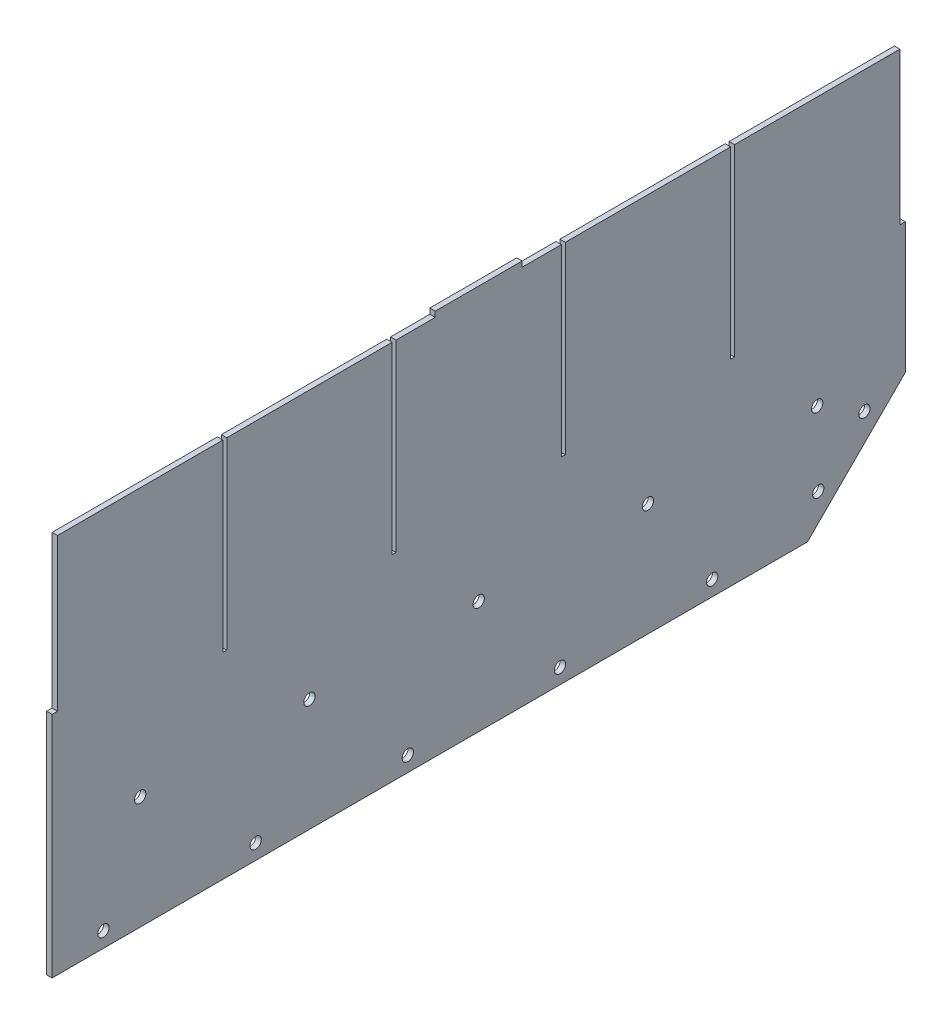
from build123d import *

# Parameters (mm, degrees)
SKETCH1_W            = 498.348
SKETCH1_H            = 165.1
BOSS_EXTRUDE1_DEPTH  = 1.5875
BOSS_EXTRUDE2_DEPTH  = 3.175
SKETCH3_R            = 3.302
CUT_EXTRUDE1_DEPTH   = 3.175
LPATTERN1_COUNT      = 5
LPATTERN1_PITCH      = 88.9
CUT_EXTRUDE2_DEPTH   = 286.681383539
LPATTERN2_COUNT      = 2
LPATTERN2_PITCH      = 38.1
SKETCH5_W            = 3.175
SKETCH5_H            = 88.9
CUT_EXTRUDE3_DEPTH   = 286.681383539
SKETCH6_W            = 2.286
SKETCH6_H            = 107.442
CUT_EXTRUDE4_DEPTH   = 286.681383539
LPATTERN3_COUNT      = 4
LPATTERN3_PITCH      = 98.8568
SKETCH7_W            = 50.8
SKETCH7_H            = 3.175
BOSS_EXTRUDE3_DEPTH  = 3.175
M6_CLEARANCE_HOLE1_D = 6.6
LPATTERN4_COUNT      = 3
LPATTERN4_PITCH      = 98.8568
LPATTERN4_COUNT_DIR2 = 3
LPATTERN4_PITCH_DIR2 = 98.8568


with BuildPart() as part:
    # Sketch1 → Boss-Extrude1 (new, symmetric)
    with BuildSketch(Plane(origin=(0, 0, 0), x_dir=(0, 0, -1), z_dir=(1, 0, 0))):
        Rectangle(SKETCH1_W, SKETCH1_H)
    extrude(amount=BOSS_EXTRUDE1_DEPTH, both=True)

    # Sketch2 → Boss-Extrude2 (add)
    with BuildSketch(Plane(origin=(1.5875, 0, 0), x_dir=(0, 0, -1), z_dir=(1, 0, 0))):
        Polygon((-249.174, -139.7), (192.024, -139.7), (249.174, -82.55), (-249.174, -82.55), align=None)
    extrude(amount=-BOSS_EXTRUDE2_DEPTH)

    # Sketch3 → Cut-Extrude1 (cut)
    with BuildSketch(Plane(origin=(1.5875, 0, 0), x_dir=(0, 0, -1), z_dir=(1, 0, 0))):
        with Locations((-219.202, -130.81)):
            Circle(SKETCH3_R)
    cut_extrude1 = extrude(amount=-CUT_EXTRUDE1_DEPTH, mode=Mode.SUBTRACT)

    # LPattern1: Cut-Extrude1 ×5
    with Locations(*[(0, 0, -i * LPATTERN1_PITCH) for i in range(1, LPATTERN1_COUNT)]):
        add(cut_extrude1, mode=Mode.SUBTRACT)

    # Sketch4 → Cut-Extrude2 (cut, through all)
    with BuildSketch(Plane(origin=(1.5875, 0, 0), x_dir=(0, 0, -1), z_dir=(1, 0, 0))):
        with BuildLine():
            ThreePointArc((195.975312693, -119.584226289), (199.573799978, -120.300009914), (201.612179285, -117.249359697))
            ThreePointArc((201.612179285, -117.249359697), (197.046558591, -114.198709481), (195.975312693, -119.584226289))
        make_face()
    cut_extrude2 = extrude(amount=-CUT_EXTRUDE2_DEPTH, mode=Mode.SUBTRACT)

    # LPattern2: Cut-Extrude2 ×2
    with Locations(*[Vector(0, 0.7071067811865489, -0.7071067811865461) * (i * LPATTERN2_PITCH) for i in range(1, LPATTERN2_COUNT)]):
        add(cut_extrude2, mode=Mode.SUBTRACT)

    # Sketch5 → Cut-Extrude3 (cut, through all)
    with BuildSketch(Plane.ZY.offset(1.5875)):
        with Locations((247.5865, 38.1)):
            Rectangle(SKETCH5_W, SKETCH5_H)
        with Locations((-247.5865, 38.1)):
            Rectangle(SKETCH5_W, SKETCH5_H)
    extrude(amount=-CUT_EXTRUDE3_DEPTH, mode=Mode.SUBTRACT)

    # Sketch6 → Cut-Extrude4 (cut, through all)
    with BuildSketch(Plane.ZY.offset(1.5875)):
        with Locations((-148.2852, 28.829)):
            Rectangle(SKETCH6_W, SKETCH6_H)
    cut_extrude4 = extrude(amount=-CUT_EXTRUDE4_DEPTH, mode=Mode.SUBTRACT)

    # LPattern3: Cut-Extrude4 ×4
    with Locations(*[(0, 0, i * LPATTERN3_PITCH) for i in range(1, LPATTERN3_COUNT)]):
        add(cut_extrude4, mode=Mode.SUBTRACT)

    # Sketch7 → Boss-Extrude3 (add)
    with BuildSketch(Plane.ZY.offset(1.5875)):
        with Locations((0, 84.1375)):
            Rectangle(SKETCH7_W, SKETCH7_H)
    extrude(amount=-BOSS_EXTRUDE3_DEPTH)

    # M6 Clearance Hole1 (through all)
    with Locations(Plane(origin=(1.5875, 0, 0), x_dir=(0, 0, -1), z_dir=(1, 0, 0))):
        with Locations((0, -73.8124)):
            m6_clearance_hole1 = Hole(M6_CLEARANCE_HOLE1_D / 2)

    # LPattern4: M6 Clearance Hole1 3 × 3
    with Locations(*[Vector(0, 0, 1) * (i * LPATTERN4_PITCH) + Vector(0, 0, -1) * (j * LPATTERN4_PITCH_DIR2) for i in range(LPATTERN4_COUNT) for j in range(LPATTERN4_COUNT_DIR2) if (i, j) != (0, 0)]):
        add(m6_clearance_hole1, mode=Mode.SUBTRACT)


solid = part.part
